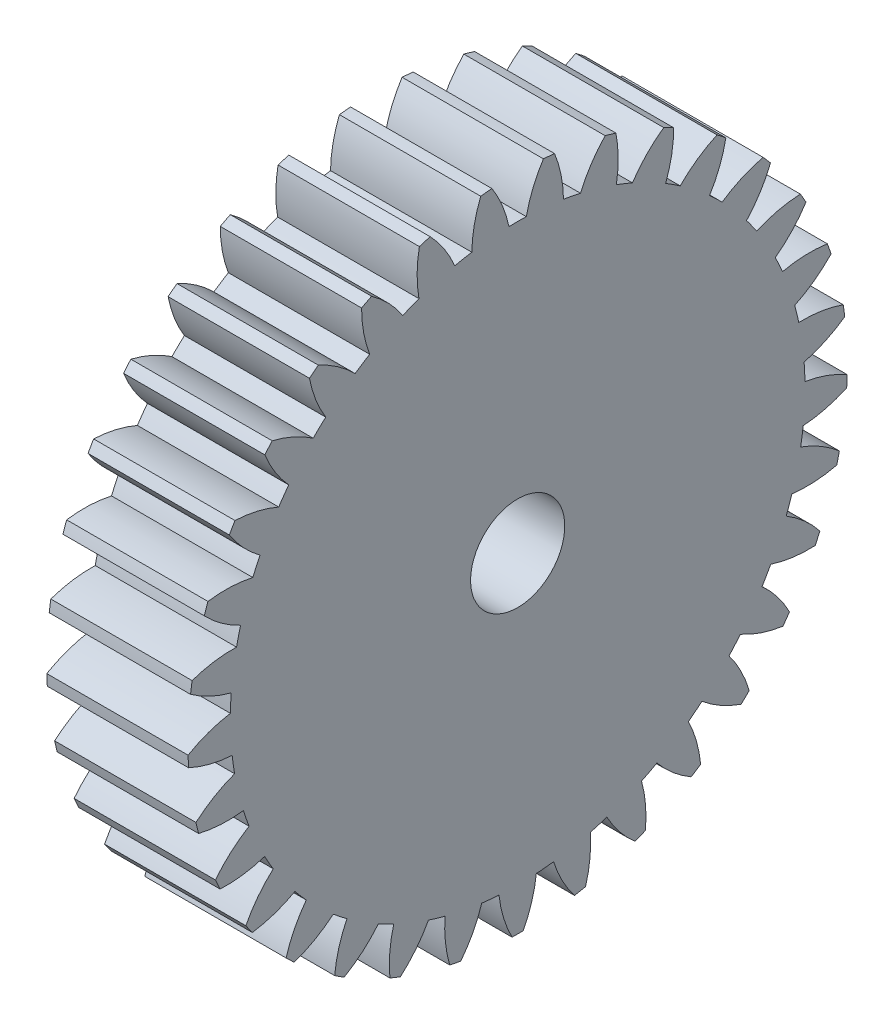
from build123d import *

# Parameters (mm, degrees)
BASPROSKE_W     = 7.5
BASPROSKE_H     = 17.5
TOOTHCUT_DEPTH  = 26.860201082
TEETHCUTS_COUNT = 33
TEETHCUTS_ANGLE = 349.090909091
BORSKE_R        = 2.5
BORE_DEPTH      = 50.0000508


with BuildPart() as part:
    # BasProSke → Base-Revolve (revolve)
    with BuildSketch(Plane(origin=(0, 0, 0), x_dir=(1, 0, 0), z_dir=(0, 1, 0))):
        with Locations((3.75, 8.75)):
            Rectangle(BASPROSKE_W, BASPROSKE_H)
    revolve(axis=Axis((-10, 0, 0), (1, 0, 0)))

    # TooCutSke → ToothCut (cut, through all)
    with BuildSketch(Plane(origin=(0, 0, 0), x_dir=(0, 0, -1), z_dir=(1, 0, 0))):
        with BuildLine():
            ThreePointArc((0.460038855, 15.242059088), (0, 15.249), (-0.460038855, 15.242059088))
            ThreePointArc((-0.460038855, 15.242059088), (-0.818271128, 16.398913356), (-1.381851371, 17.470836613))
            ThreePointArc((-1.381851371, 17.470836613), (0, 17.5254), (1.381851371, 17.470836613))
            ThreePointArc((1.381851371, 17.470836613), (0.818271128, 16.398913356), (0.460038855, 15.242059088))
        make_face()
    toothcut = extrude(amount=TOOTHCUT_DEPTH, mode=Mode.SUBTRACT)

    # TeethCuts: ToothCut ×33 about axis
    teethcuts_axis = Axis((-10, 0, 0), (1, 0, 0))
    for i in range(1, TEETHCUTS_COUNT):
        add(toothcut.rotate(teethcuts_axis, i * TEETHCUTS_ANGLE / (TEETHCUTS_COUNT - 1)), mode=Mode.SUBTRACT)

    # BorSke → Bore (cut, symmetric)
    with BuildSketch(Plane(origin=(0, 0, 0), x_dir=(0, 0, -1), z_dir=(1, 0, 0))):
        Circle(BORSKE_R)
    extrude(amount=BORE_DEPTH, both=True, mode=Mode.SUBTRACT)


solid = part.part
